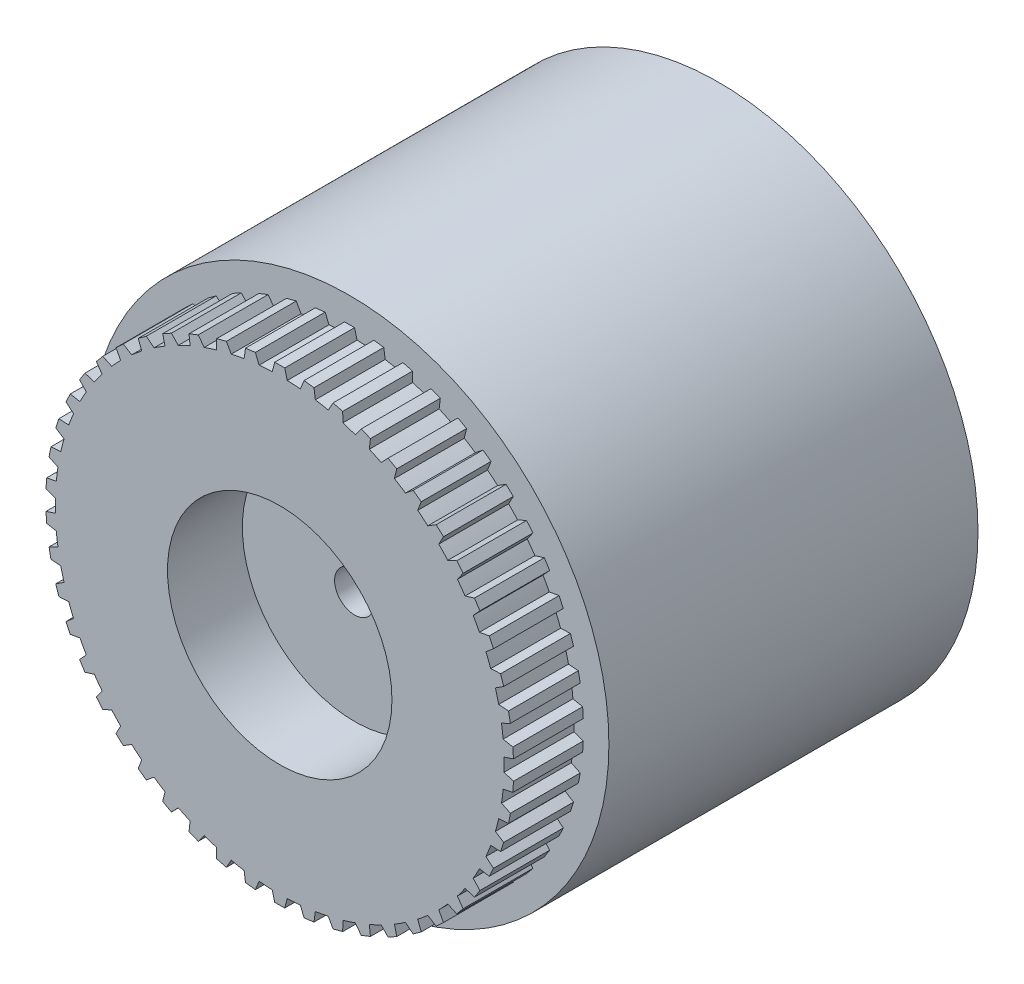
from build123d import *

# Parameters (mm, degrees)
SKETCH1_R           = 26
BOSS_EXTRUDE1_DEPTH = 37
SKETCH2_R           = 22.5
BOSS_EXTRUDE2_DEPTH = 7
BOSS_EXTRUDE3_DEPTH = 7
CIRPATTERN1_COUNT   = 50
SKETCH4_R           = 6.75
CUT_EXTRUDE1_DEPTH  = 5.5
SKETCH5_R           = 2
CUT_EXTRUDE2_DEPTH  = 54.23767463
SKETCH6_R           = 11.25
CUT_EXTRUDE3_DEPTH  = 7.5


with BuildPart() as part:
    # Sketch1 → Boss-Extrude1 (new body)
    with BuildSketch(Plane.XY):
        Circle(SKETCH1_R)
    extrude(amount=BOSS_EXTRUDE1_DEPTH)

    # Sketch2 → Boss-Extrude2 (add)
    with BuildSketch(Plane.XY.offset(37)):
        Circle(SKETCH2_R)
    extrude(amount=BOSS_EXTRUDE2_DEPTH)

    # Sketch3 → Boss-Extrude3 (add)
    with BuildSketch(Plane.XY.offset(44)):
        Polygon((0, 23.445373418), (-0.5, 23.445373418), (-1.79775122, 18.602099929), (1.79775122, 18.602099929), (0.5, 23.445373418), align=None)
    boss_extrude3 = extrude(amount=-BOSS_EXTRUDE3_DEPTH)

    # CirPattern1: Boss-Extrude3 ×50 about axis
    cirpattern1_axis = Axis((0, 0, 44), (0, 0, -1))
    for i in range(1, CIRPATTERN1_COUNT):
        add(boss_extrude3.rotate(cirpattern1_axis, i * 360 / CIRPATTERN1_COUNT))

    # Sketch4 → Cut-Extrude1 (cut)
    with BuildSketch(Plane(origin=(0, 0, 0), x_dir=(-1, 0, 0), z_dir=(0, 0, -1))):
        Circle(SKETCH4_R)
    extrude(amount=-CUT_EXTRUDE1_DEPTH, mode=Mode.SUBTRACT)

    # Sketch5 → Cut-Extrude2 (cut, through all)
    with BuildSketch(Plane(origin=(0, 0, 5.5), x_dir=(-1, 0, 0), z_dir=(0, 0, -1))):
        Circle(SKETCH5_R)
    extrude(amount=-CUT_EXTRUDE2_DEPTH, mode=Mode.SUBTRACT)

    # Sketch6 → Cut-Extrude3 (cut)
    with BuildSketch(Plane.XY.offset(44)):
        Circle(SKETCH6_R)
    extrude(amount=-CUT_EXTRUDE3_DEPTH, mode=Mode.SUBTRACT)


solid = part.part
